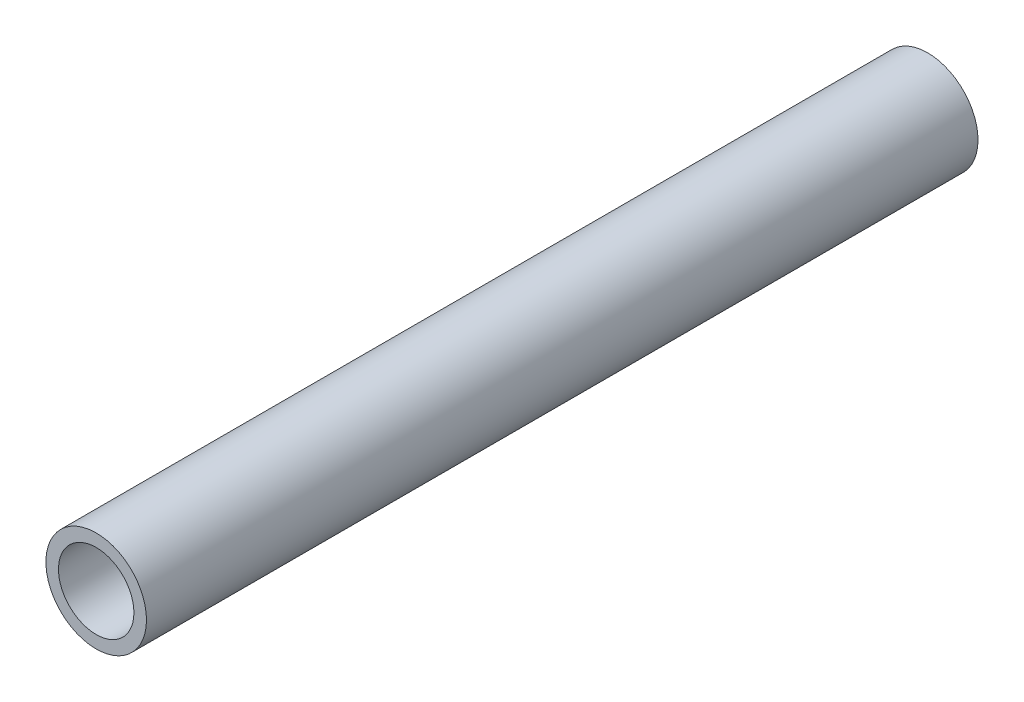
from build123d import *

# Parameters (mm, degrees)
SKETCH1_R           = 25.4
SKETCH1_R_2         = 19.05
BOSS_EXTRUDE1_DEPTH = 420


with BuildPart() as part:
    # Sketch1 → Boss-Extrude1 (new body)
    with BuildSketch(Plane.XY):
        Circle(SKETCH1_R)
        Circle(SKETCH1_R_2, mode=Mode.SUBTRACT)
    extrude(amount=BOSS_EXTRUDE1_DEPTH)


solid = part.part
